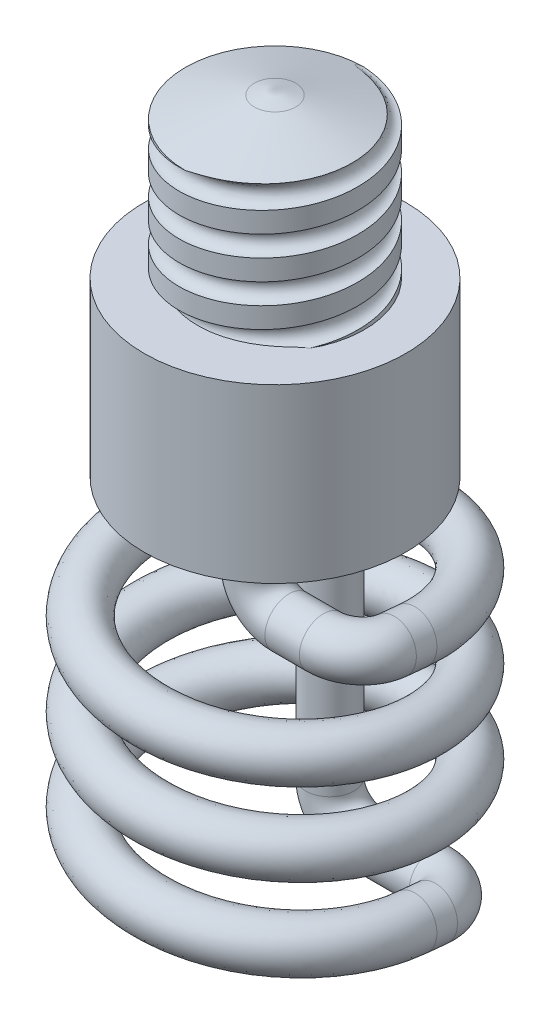
from build123d import *

# Parameters (mm, degrees)
SWEEP_4_PITCH       = 12
SWEEP_4_HEIGHT      = 36
SWEEP_4_RADIUS      = 20
SWEEP_4_START_ANGLE = 90
SWEEP_4_PROFILE_R   = 3.5
SWEEP_5_PROFILE_R   = 3.5
SWEEP_6_PROFILE_R   = 3.5
SKETCH_44_R         = 51.30209513
CUT_EXTRUDE_1_DEPTH = 66
SKETCH_45_R         = 19
EXTRUDE_1_DEPTH     = 25
SKETCH_47_R         = 13
EXTRUDE_2_DEPTH     = 20
SWEEP_1_PITCH       = 6
EXTRUDE_START       = -10
SKETCH_56_R         = 19
EXTRUDE_3_DEPTH     = 10


with BuildPart() as part:
    # 扫描4: sweep along a helix
    with BuildLine() as sweep_4_path:
        add(Helix(SWEEP_4_PITCH, SWEEP_4_HEIGHT, SWEEP_4_RADIUS, center=(0, 0, 0), direction=(0, 1, 0), lefthand=True, mode=Mode.PRIVATE).rotate(Axis((0, 0, 0), (0, 1, 0)), SWEEP_4_START_ANGLE))
    # 扫描4 profile (on start of the path) → 扫描4 (sweep)
    with BuildSketch(Plane(origin=(20, 0, 0), x_dir=(0, 0.9954714945707673, -0.0950605254405987), z_dir=(9.459251983172826e-13, 0.0950605254405987, 0.9954714945707673))):
        Circle(SWEEP_4_PROFILE_R)
    sweep(path=sweep_4_path.line, is_frenet=True)

    # 扫描5: sweep along a curve in space
    with BuildLine() as sweep_5_path:
        Line((20, 0, 0), (20, -0.285181576, -2.986414484))
        ThreePointArc((15, -0.760484204, -7.963771957), (18.535533906, -0.621271287, -6.505937705), (20, -0.285181576, -2.986414484))
        Line((15, -0.760484204, -7.963771957), (5, -0.760484204, -7.963771957))
        ThreePointArc((5, -0.760484204, -7.963771957), (1.464466094, 0.703981891, -7.963771957), (0, 4.239515796, -7.963771957))
        Line((0, 4.239515796, -7.963771957), (0, 75.239515796, -7.963771957))
    # 扫描5 profile (on start of the path) → 扫描5 (sweep)
    with BuildSketch(Plane(origin=(20, 0, 0), x_dir=(0, -0.9954714945707475, 0.09506052544080659), z_dir=(-4.736951571733868e-15, -0.09506052544080659, -0.9954714945707475))):
        Circle(SWEEP_5_PROFILE_R)
    sweep(path=sweep_5_path.line)

    # 扫描6: sweep along a curve in space
    with BuildLine() as sweep_6_path:
        Line((20, 36, 0), (20, 36.285181576, 2.986414484))
        ThreePointArc((15, 36.760484204, 7.963771957), (18.535533906, 36.621271287, 6.505937705), (20, 36.285181576, 2.986414484))
        Line((15, 36.760484204, 7.963771957), (10, 36.760484204, 7.963771957))
        ThreePointArc((5, 41.760484204, 7.963771957), (6.464466094, 38.224950298, 7.963771957), (10, 36.760484204, 7.963771957))
        Line((5, 41.760484204, 7.963771957), (5, 71.760484204, 7.963771957))
    # 扫描6 profile (on start of the path) → 扫描6 (sweep)
    with BuildSketch(Plane(origin=(20, 36, 0), x_dir=(0, 0.9954714945707477, -0.09506052544080437), z_dir=(-1.776356839400193e-14, 0.09506052544080437, 0.9954714945707477))):
        Circle(SWEEP_6_PROFILE_R)
    sweep(path=sweep_6_path.line)

    # 草图44 → 切除-拉伸1 (cut)
    with BuildSketch(Plane(origin=(0, 46, 0), x_dir=(1, 0, 0), z_dir=(0, 1, 0))):
        Circle(SKETCH_44_R)
    extrude(amount=CUT_EXTRUDE_1_DEPTH, mode=Mode.SUBTRACT)

    # 草图45 → 凸台-拉伸1 (add)
    with BuildSketch(Plane(origin=(0, 46, 0), x_dir=(1, 0, 0), z_dir=(0, 1, 0))):
        with Locations(Location((0, 0, 0), (0, 0, 270))):
            Circle(SKETCH_45_R)
    extrude(amount=EXTRUDE_1_DEPTH)

    # 草图47 → 凸台-拉伸2 (add)
    with BuildSketch(Plane(origin=(0, 71, 0), x_dir=(1, 0, 0), z_dir=(0, 1, 0))):
        with Locations(Location((0, 0, 0), (0, 0, 270))):
            Circle(SKETCH_47_R)
    extrude(amount=EXTRUDE_2_DEPTH)

    # 放样1: read off the stored shape, not the designer's step
    # 放样1: loft between two sections, ruled curve by curve
    loft_1_from = [
        Edge.make_bspline([(-2.528955763, 94, 1.613810011), (-5.756575784, 94, -3.444101515), (-0.698664258, 94, -6.671721536), (2.528955763, 94, -1.613810011), (5.756575784, 94, 3.444101515), (0.698664258, 94, 6.671721536), (-2.528955763, 94, 1.613810011)], [0, 0, 0, 0, 0.5, 0.5, 0.5, 1, 1, 1, 1], 3, [1, 0.333333333, 0.333333333, 1, 0.333333333, 0.333333333, 1]),
    ]
    loft_1_to = [
        Edge.make_bspline([(-8.827408281, 91, 9.543419882), (-27.914248044, 91, -8.111396681), (-10.259431482, 91, -27.198236444), (8.827408281, 91, -9.543419882), (27.914248044, 91, 8.111396681), (10.259431482, 91, 27.198236444), (-8.827408281, 91, 9.543419882)], [0, 0, 0, 0, 0.5, 0.5, 0.5, 1, 1, 1, 1], 3, [1, 0.333333333, 0.333333333, 1, 0.333333333, 0.333333333, 1]),
    ]
    loft_1 = Solid(Shell([*[Face.make_surface_from_curves(loft_1_from[k], loft_1_to[k]) for k in range(1)], Face(Wire(loft_1_from)), Face(Wire(loft_1_to))]))
    add(loft_1)

    # 草图50 → 旋转1 (revolve)
    with BuildSketch(Plane.XY, mode=Mode.PRIVATE) as revolve_1_sk:
        Polygon((0, 94.8), (3, 94), (0, 94), align=None)
    revolve(revolve_1_sk.sketch.rotate(Axis((0, 94, 0), (0, 1, 0)), 227.232), axis=Axis((0, 94, 0), (0, 1, 0)))

    # 切除-扫描1: arcs per turn and ends read off the stored shape
    # 切除-扫描1: the profile of 切除-扫描1 profile screwed along a right-hand helix through 4.5 turns, 14 arcs to a turn; built about Z, then put on its axis
    sweep_1_z = Axis((0, 0, 0), (0, 0, 1))
    sweep_1_corners = [(13, 0.109888123, -7.495969452), (11.5, 0, -6), (13, -0.109888123, -4.504030548), (14.5, 0, -6)]
    with BuildLine(mode=Mode.PRIVATE) as sweep_1_profile:
        ThreePointArc((13, 0.109888123, -7.495969452), (11.939339828, 0.077702637, -7.057810144), (11.5, 0, -6))
        ThreePointArc((11.5, 0, -6), (11.939339828, -0.077702637, -4.942189856), (13, -0.109888123, -4.504030548))
        ThreePointArc((13, -0.109888123, -4.504030548), (14.060660172, -0.077702637, -4.942189856), (14.5, 0, -6))
        ThreePointArc((14.5, 0, -6), (14.060660172, 0.077702637, -7.057810144), (13, 0.109888123, -7.495969452))
    sweep_1_cap = Face(sweep_1_profile.wire())
    sweep_1_arcs = [((13, 0.109888123, -7.495969452), (11.5, 0.109888123, -7.495969452), (11.5, 0, -6), (1, 0.7071067811865475, 1)), ((11.5, 0, -6), (11.5, -0.109888123, -4.504030548), (13, -0.109888123, -4.504030548), (1, 0.7071067811865475, 1)), ((13, -0.109888123, -4.504030548), (14.5, -0.109888123, -4.504030548), (14.5, 0, -6), (1, 0.7071067811865475, 1)), ((14.5, 0, -6), (14.5, 0.109888123, -7.495969452), (13, 0.109888123, -7.495969452), (1, 0.7071067811865475, 1))]  # start, shoulder, end, weights
    sweep_1_turn_angles = [0, 12.857142857, 25.714285714, 38.571428571, 51.428571429, 64.285714286, 77.142857143, 90, 102.857142857, 115.714285714, 128.571428571, 141.428571429, 154.285714286, 167.142857143, 180, 192.857142857, 205.714285714, 218.571428571, 231.428571429, 244.285714286, 257.142857143, 270, 282.857142857, 295.714285714, 308.571428571, 321.428571429, 334.285714286, 347.142857143, 360]
    sweep_1_turn_weights = [1, 0.9749279121818236, 1, 0.9749279121818236, 1, 0.9749279121818236, 1, 0.9749279121818236, 1, 0.9749279121818236, 1, 0.9749279121818236, 1, 0.9749279121818236, 1, 0.9749279121818236, 1, 0.9749279121818236, 1, 0.9749279121818236, 1, 0.9749279121818236, 1, 0.9749279121818237, 1, 0.9749279121818236, 1, 0.9749279121818236, 1]
    sweep_1_turn_sides = [Face.make_bezier_surface([[Vector(p[j][0], p[j][1], 0).rotate(sweep_1_z, sweep_1_turn_angles[2 * i + k]) / sweep_1_turn_weights[2 * i + k] + Vector(0, 0, p[j][2] + SWEEP_1_PITCH * sweep_1_turn_angles[2 * i + k] / 360) for k in range(3)] for j in range(3)], [[p[3][j] * sweep_1_turn_weights[2 * i + k] for k in range(3)] for j in range(3)]) for p in sweep_1_arcs for i in range(14)]
    sweep_1_last_angles = [1440, 1452.857142857, 1465.714285714, 1478.571428571, 1491.428571429, 1504.285714286, 1517.142857143, 1530, 1542.857142857, 1555.714285714, 1568.571428571, 1581.428571429, 1594.285714286, 1607.142857143, 1620]
    sweep_1_last_weights = [1, 0.9749279121818235, 1, 0.974927912181824, 1, 0.9749279121818235, 1, 0.9749279121818235, 1, 0.9749279121818235, 1, 0.974927912181824, 1, 0.9749279121818235, 1]
    sweep_1_last_sides = [Face.make_bezier_surface([[Vector(p[j][0], p[j][1], 0).rotate(sweep_1_z, sweep_1_last_angles[2 * i + k]) / sweep_1_last_weights[2 * i + k] + Vector(0, 0, p[j][2] + SWEEP_1_PITCH * sweep_1_last_angles[2 * i + k] / 360) for k in range(3)] for j in range(3)], [[p[3][j] * sweep_1_last_weights[2 * i + k] for k in range(3)] for j in range(3)]) for p in sweep_1_arcs for i in range(7)]
    sweep_1 = Plane(origin=(0, 91, 0), x_dir=(1, 0, 0), z_dir=(0, -1, 0)) * Solid(Shell([*[p.moved(Location((0, 0, SWEEP_1_PITCH * i))) for i in range(4) for p in sweep_1_turn_sides], *sweep_1_last_sides, sweep_1_cap, sweep_1_cap.rotate(sweep_1_z, 1620).moved(Location((0, 0, SWEEP_1_PITCH * 1620 / 360)))]))
    add(sweep_1, mode=Mode.SUBTRACT)

    # 草图56 → 凸台-拉伸3 (add)
    with BuildSketch(Plane(origin=(0, 71, 0), x_dir=(1, 0, 0), z_dir=(0, 1, 0)).offset(EXTRUDE_START)):
        with Locations(Location((0, 0, 0), (0, 0, 270))):
            Circle(SKETCH_56_R)
    extrude(amount=EXTRUDE_3_DEPTH)


solid = part.part
